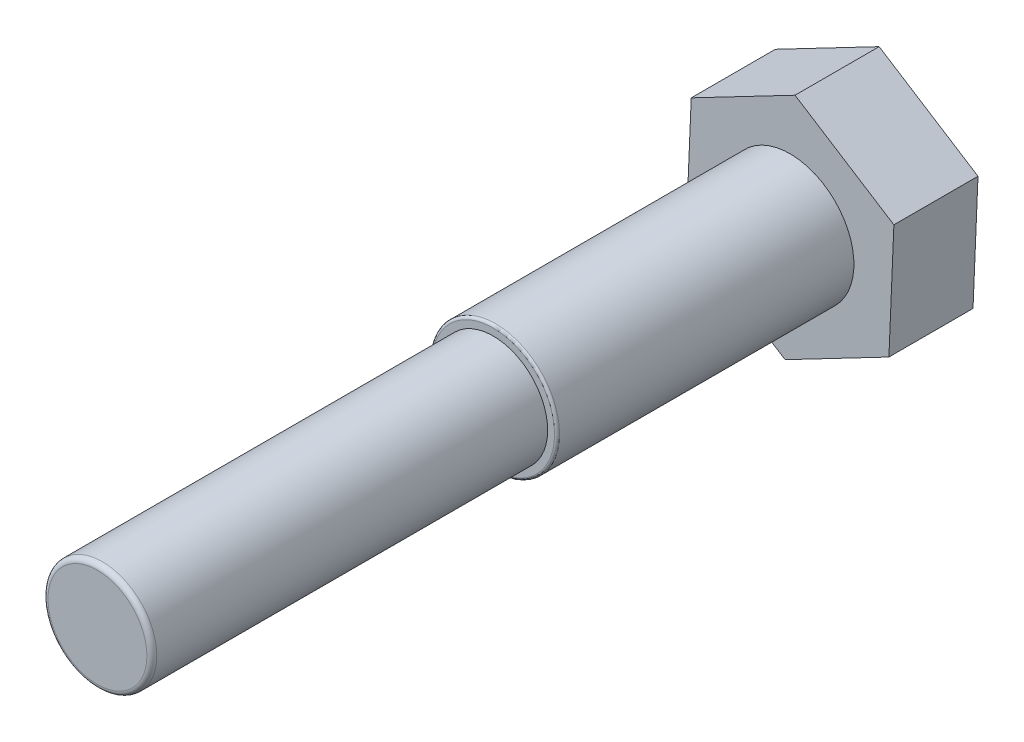
from build123d import *

# Parameters (mm, degrees)
EXTRUDE_307_DEPTH = 17
SKETCH_2_R        = 12.9
EXTRUDE_1_DEPTH   = 60
SKETCH_3_R        = 11
EXTRUDE_2_DEPTH   = 80
FILLET_2_R        = 1
FILLET_4_R        = 0.5


with BuildPart() as part:
    # 草图1 → Extrude 307 (new body)
    with BuildSketch(Plane.XY):
        Polygon((20.984201837, 10.954296262), (1.005402075, 23.65), (-19.978799762, 12.695703738), (-20.984201837, -10.954296262), (-1.005402075, -23.65), (19.978799762, -12.695703738), align=None)
    extrude(amount=EXTRUDE_307_DEPTH)

    # 草图2 → 凸台-拉伸1 (add)
    with BuildSketch(Plane.XY.offset(17)):
        Circle(SKETCH_2_R)
    extrude(amount=EXTRUDE_1_DEPTH)

    # 草图3 → 凸台-拉伸2 (add)
    with BuildSketch(Plane.XY.offset(77)):
        Circle(SKETCH_3_R)
    extrude(amount=EXTRUDE_2_DEPTH)

    # 圆角2
    fillet_2_edges = [part.edges().sort_by_distance(p)[0] for p in [
        (-11, 0, 157),
    ]]
    fillet(fillet_2_edges, radius=FILLET_2_R)

    # 圆角4
    fillet_4_edges = [part.edges().sort_by_distance(p)[0] for p in [
        (-12.9, 0, 77),
    ]]
    fillet(fillet_4_edges, radius=FILLET_4_R)


solid = part.part
